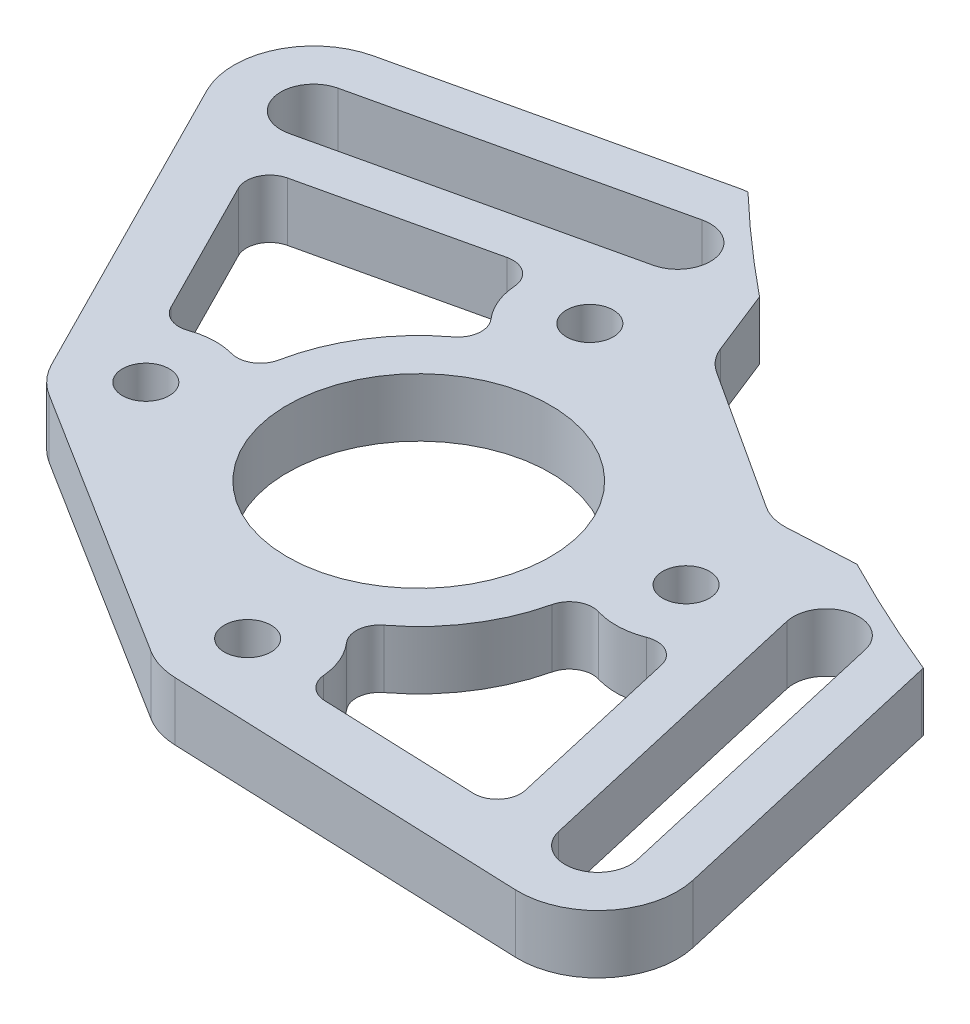
from build123d import *

# Parameters (mm, degrees)
SKETCH1_R           = 2.54
SKETCH1_R_2         = 14.2875
BOSS_EXTRUDE1_DEPTH = 6.35
SKETCH3_R           = 175
CUT_EXTRUDE1_DEPTH  = 70.66923735
FILLET1_R           = 2.54


with BuildPart() as part:
    # Sketch1 → Boss-Extrude1 (new body)
    with BuildSketch(Plane(origin=(0, 0, 0), x_dir=(1, 0, 0), z_dir=(0, 1, 0))):
        with BuildLine():
            Line((-10.301536111, 44.922263418), (-42.486128255, 37.541719497))
            ThreePointArc((-42.486128255, 37.541719497), (-48.376257791, 32.787738977), (-48.258608454, 25.219376184))
            Line((-48.258608454, 25.219376184), (-30.922632743, -8.978011563))
            ThreePointArc((-30.922632743, -8.978011563), (-29.753188396, -10.670651305), (-28.173552503, -11.988748349))
            Line((-28.173552503, -11.988748349), (1.485082186, -30.582244497))
            ThreePointArc((1.485082186, -30.582244497), (3.286793362, -31.407609936), (5.240405543, -31.740462332))
            Line((5.240405543, -31.740462332), (43.718670442, -33.216869907))
            ThreePointArc((43.718670442, -33.216869907), (50.700017874, -30.096753296), (52.467298047, -22.656923969))
            Line((52.467298047, -22.656923969), (45.086754126, 9.527668174))
            ThreePointArc((45.086754126, 9.527668174), (41.870070274, 14.491711544), (36.213465331, 16.221336388))
            Line((36.213465331, 16.221336388), (24.402688291, 15.597131936))
            ThreePointArc((24.402688291, 15.597131936), (22.820864626, 15.76285886), (21.367816063, 16.409605637))
            Line((21.367816063, 16.409605637), (5.906875614, 26.450057762))
            ThreePointArc((5.906875614, 26.450057762), (4.742385284, 27.493110687), (3.950204921, 28.84086712))
            Line((3.950204921, 28.84086712), (-0.341397124, 39.683137821))
            ThreePointArc((-0.341397124, 39.683137821), (-4.350888408, 44.147873767), (-10.301536111, 44.922263418))
        make_face()
        with Locations((-5.53256927, 24.126065418)):
            Circle(SKETCH1_R, mode=Mode.SUBTRACT)
        with Locations((24.290556126, 4.758701333)):
            Circle(SKETCH1_R, mode=Mode.SUBTRACT)
        with Locations((5.53256927, -24.126065418)):
            Circle(SKETCH1_R, mode=Mode.SUBTRACT)
        with Locations((-24.126065418, -5.53256927)):
            Circle(SKETCH1_R, mode=Mode.SUBTRACT)
        Circle(SKETCH1_R_2, mode=Mode.SUBTRACT)
        with BuildLine():
            Line((40.135278412, 8.392199879), (47.515822333, -23.792392264))
            ThreePointArc((47.515822333, -23.792392264), (44.84461714, -28.053253071), (40.583756333, -25.382047878))
            Line((40.583756333, -25.382047878), (33.203212412, 6.802544265))
            ThreePointArc((33.203212412, 6.802544265), (35.874417605, 11.063405072), (40.135278412, 8.392199879))
        make_face(mode=Mode.SUBTRACT)
        with BuildLine():
            Line((-7.576412202, 33.038721704), (-39.761004345, 25.658177783))
            ThreePointArc((-39.761004345, 25.658177783), (-44.021865152, 28.329382976), (-41.350659959, 32.590243783))
            Line((-41.350659959, 32.590243783), (-9.166067816, 39.970787704))
            ThreePointArc((-9.166067816, 39.970787704), (-4.905207009, 37.299582511), (-7.576412202, 33.038721704))
        make_face(mode=Mode.SUBTRACT)
    extrude(amount=BOSS_EXTRUDE1_DEPTH)

    # Sketch3 → Cut-Extrude1 (cut, through all)
    with BuildSketch(Plane(origin=(0, 6.35, 0), x_dir=(1, 0, 0), z_dir=(0, 1, 0))):
        with Locations((111.500681804, 171.695993352)):
            Circle(SKETCH3_R)
        with BuildLine():
            Line((29.692484449, -0.615642385), (35.632280619, -26.517516174))
            ThreePointArc((35.632280619, -26.517516174), (35.636280873, -26.534877998), (35.640316938, -26.552231532))
            Line((35.640316938, -26.552231532), (12.991771922, -25.68320889))
            ThreePointArc((12.991771922, -25.68320889), (12.360044144, -20.742282498), (8.810828705, -17.247299898))
            ThreePointArc((8.810828705, -17.247299898), (16.242952225, -10.548296511), (19.339879369, -1.033983679))
            ThreePointArc((19.339879369, -1.033983679), (24.598223728, -2.85508489), (29.692484449, -0.615642385))
        make_face()
        with BuildLine():
            Line((-38.62553605, 20.706702069), (-12.723662261, 26.646498238))
            ThreePointArc((-12.723662261, 26.646498238), (-12.567344847, 21.197527799), (-8.810828705, 17.247299898))
            ThreePointArc((-8.810828705, 17.247299898), (-16.40945516, 10.287363006), (-19.363045216, 0.415374791))
            ThreePointArc((-19.363045216, 0.415374791), (-23.979054852, 2.086012481), (-28.656078555, 0.594696105))
            Line((-28.656078555, 0.594696105), (-38.829256345, 20.662566027))
            ThreePointArc((-38.829256345, 20.662566027), (-38.727263029, 20.684019377), (-38.62553605, 20.706702069))
        make_face()
    extrude(amount=-CUT_EXTRUDE1_DEPTH, mode=Mode.SUBTRACT)

    # Fillet1
    fillet1_edges = [part.edges().sort_by_distance(p)[0] for p in [
        (35.640316938, 3.175, 26.552231532),
        (8.810828705, 3.175, 17.247299898),
        (12.991771922, 3.175, 25.68320889),
        (29.692484449, 3.175, 0.615642385),
        (19.339879369, 3.175, 1.033983679),
        (-38.829256345, 3.175, -20.662566027),
        (-28.656078555, 3.175, -0.594696105),
        (-19.363045216, 3.175, -0.415374791),
        (-8.810828705, 3.175, -17.247299898),
        (-12.723662261, 3.175, -26.646498238),
    ]]
    fillet(fillet1_edges, radius=FILLET1_R)


solid = part.part
